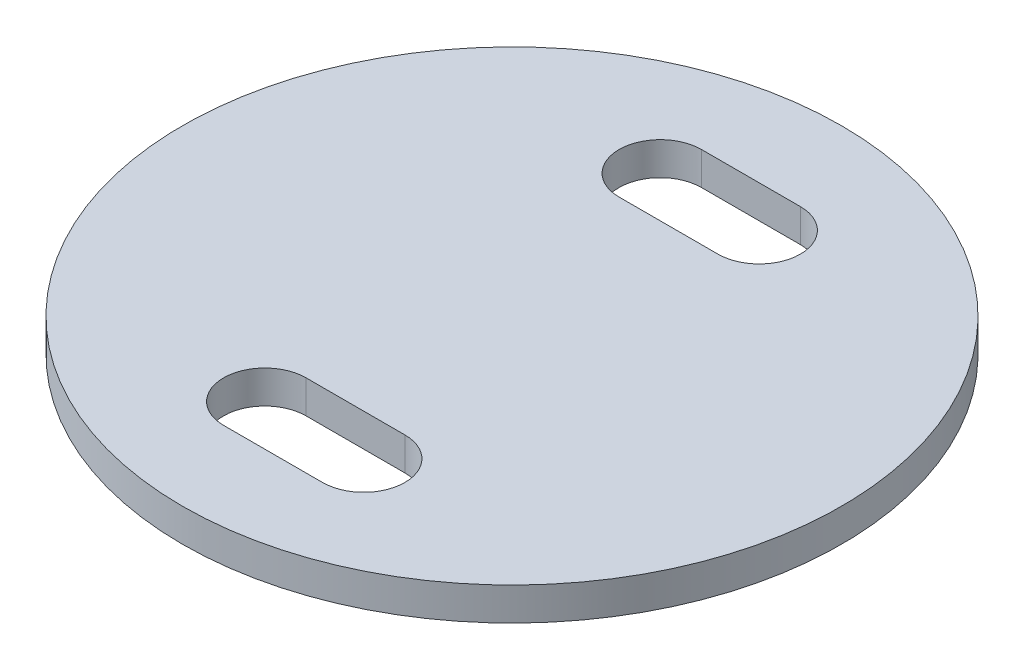
from build123d import *

# Parameters (mm, degrees)
SKETCH1_R           = 100
BOSS_EXTRUDE1_DEPTH = 10
CUT_EXTRUDE1_DEPTH  = 142.774468788


with BuildPart() as part:
    # Sketch1 → Boss-Extrude1 (new body)
    with BuildSketch(Plane(origin=(0, 0, 0), x_dir=(1, 0, 0), z_dir=(0, 1, 0))):
        Circle(SKETCH1_R)
    extrude(amount=BOSS_EXTRUDE1_DEPTH)

    # Sketch2 → Cut-Extrude1 (cut, through all)
    with BuildSketch(Plane(origin=(0, 10, 0), x_dir=(1, 0, 0), z_dir=(0, 1, 0))):
        with BuildLine():
            Line((-15, -47.5), (15, -47.5))
            ThreePointArc((15, -47.5), (27.5, -60), (15, -72.5))
            Line((15, -72.5), (-15, -72.5))
            ThreePointArc((-15, -72.5), (-27.5, -60), (-15, -47.5))
        make_face()
    cut_extrude1 = extrude(amount=-CUT_EXTRUDE1_DEPTH, mode=Mode.SUBTRACT)

    # Mirror1: Cut-Extrude1 across plane
    add(cut_extrude1.mirror(Plane.XY), mode=Mode.SUBTRACT)


solid = part.part
